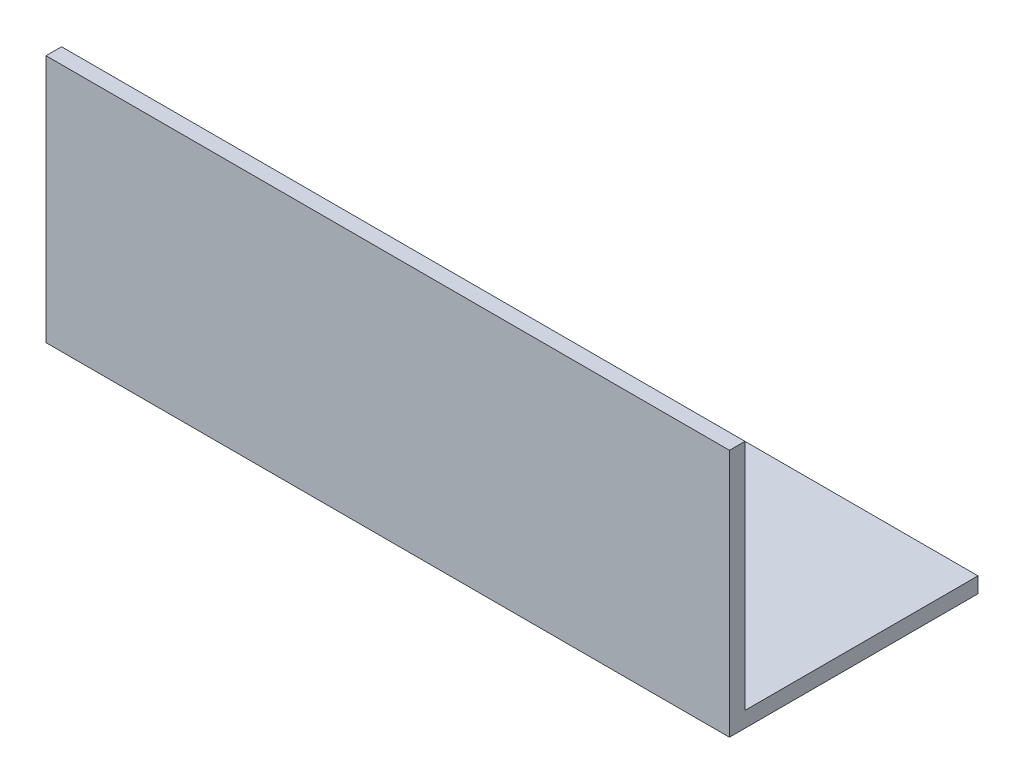
from build123d import *

# Parameters (mm, degrees)
EXTRUDE_1_DEPTH = 220


with BuildPart() as part:
    # Эскиз1 → Вытянуть-Тонкостенный1 (new body)
    with BuildSketch(Plane(origin=(0, 0, 0), x_dir=(0, 0, -1), z_dir=(1, 0, 0))):
        Polygon((75, 0), (0, 0), (0, 75), (-5, 75), (-5, -5), (75, -5), align=None)
    extrude(amount=EXTRUDE_1_DEPTH)


solid = part.part
